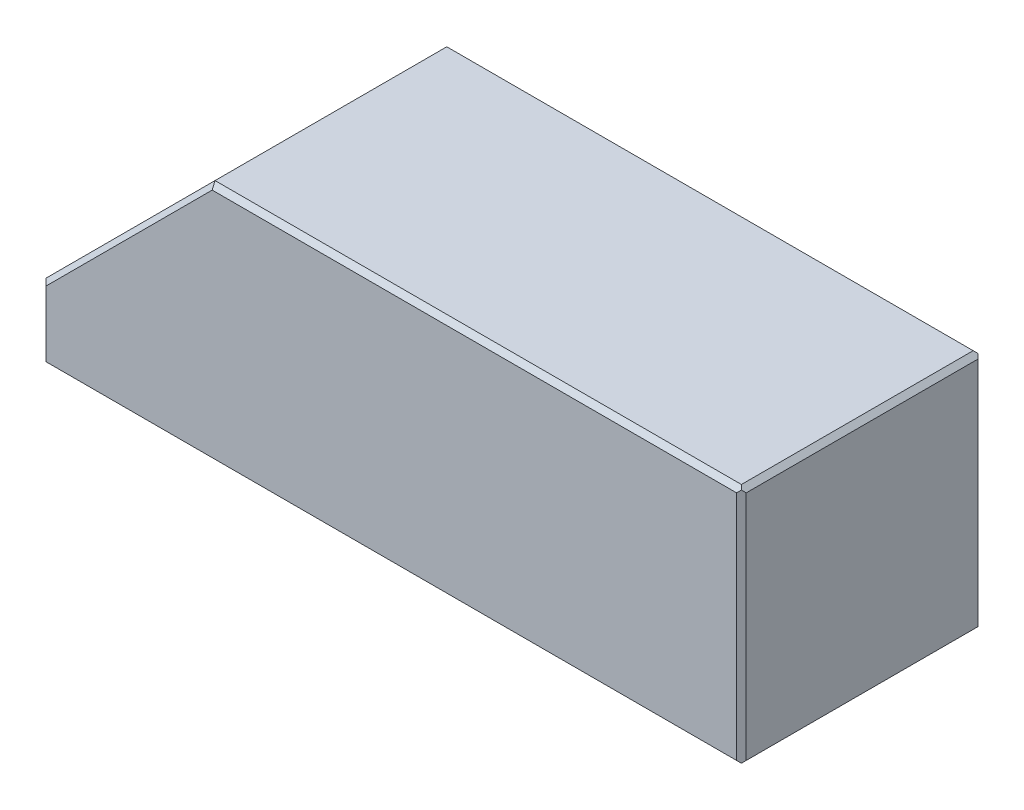
from build123d import *

# Parameters (mm, degrees)
SKETCH1_W                      = 145
SKETCH1_H                      = 49.99
BOSS_EXTRUDE1_DEPTH            = 24.995
CUT_EXTRUDE1_DEPTH             = 81.658229896
CUT_EXTRUDE1_DEPTH_BACK        = 81.658229896
F_12_0_12_DIAMETER_HOLE1_D     = 12
F_12_0_12_DIAMETER_HOLE1_DEPTH = 20.5
M10_TAPPED_HOLE2_D             = 8.5
M10_TAPPED_HOLE2_DEPTH         = 24.946342369
M10_TAPPED_HOLE2_TIP           = 2.553657631
CHAMFER1_SIZE                  = 1
CHAMFER2_SIZE                  = 1
CHAMFER3_SIZE                  = 1


with BuildPart() as part:
    # Sketch1 → Boss-Extrude1 (new, symmetric)
    with BuildSketch(Plane.XY):
        Rectangle(SKETCH1_W, SKETCH1_H)
    extrude(amount=BOSS_EXTRUDE1_DEPTH, both=True)

    # Sketch2 → Cut-Extrude1 (cut, two sides: drawn at the far end of the back side and taken through both)
    with BuildSketch(Plane.XY.offset(-CUT_EXTRUDE1_DEPTH_BACK)):
        Polygon((-72.5, -10.005), (-37.5, 24.995), (-72.5, 24.995), align=None)
    extrude(amount=CUT_EXTRUDE1_DEPTH + CUT_EXTRUDE1_DEPTH_BACK, mode=Mode.SUBTRACT)

    # Ø12.0 (12) Diameter Hole1
    with Locations(Plane.ZY.offset(72.5)):
        with Locations((0, -4.995)):
            Hole(F_12_0_12_DIAMETER_HOLE1_D / 2, depth=F_12_0_12_DIAMETER_HOLE1_DEPTH)

    # M10 Tapped Hole2
    with Locations(Plane.ZY.offset(52)):
        with Locations((0, -4.995)):
            Hole(M10_TAPPED_HOLE2_D / 2, depth=M10_TAPPED_HOLE2_DEPTH)
            with Locations((0, 0, -(M10_TAPPED_HOLE2_DEPTH + M10_TAPPED_HOLE2_TIP / 2))):  # 118° drill point
                Cone(0, M10_TAPPED_HOLE2_D / 2, M10_TAPPED_HOLE2_TIP, mode=Mode.SUBTRACT)

    # Chamfer1
    chamfer1_edges = [part.edges().sort_by_distance(p)[0] for p in [
        (-72.5, -17.5, -24.995),
        (0, -24.995, -24.995),
        (72.5, 0, -24.995),
        (17.5, 24.995, -24.995),
        (-55, 7.495, -24.995),
        (72.5, 0, 24.995),
        (0, -24.995, 24.995),
        (-72.5, -17.5, 24.995),
        (-55, 7.495, 24.995),
        (17.5, 24.995, 24.995),
    ]]
    chamfer(chamfer1_edges, length=CHAMFER1_SIZE)

    # Chamfer2
    chamfer2_edges = [part.edges().sort_by_distance(p)[0] for p in [
        (72.5, -24.995, 0),
        (72.5, 24.995, 0),
    ]]
    chamfer(chamfer2_edges, length=CHAMFER2_SIZE)

    # Chamfer3
    chamfer3_edges = [part.edges().sort_by_distance(p)[0] for p in [
        (-72.5, -24.995, 0),
    ]]
    chamfer(chamfer3_edges, length=CHAMFER3_SIZE)


solid = part.part
